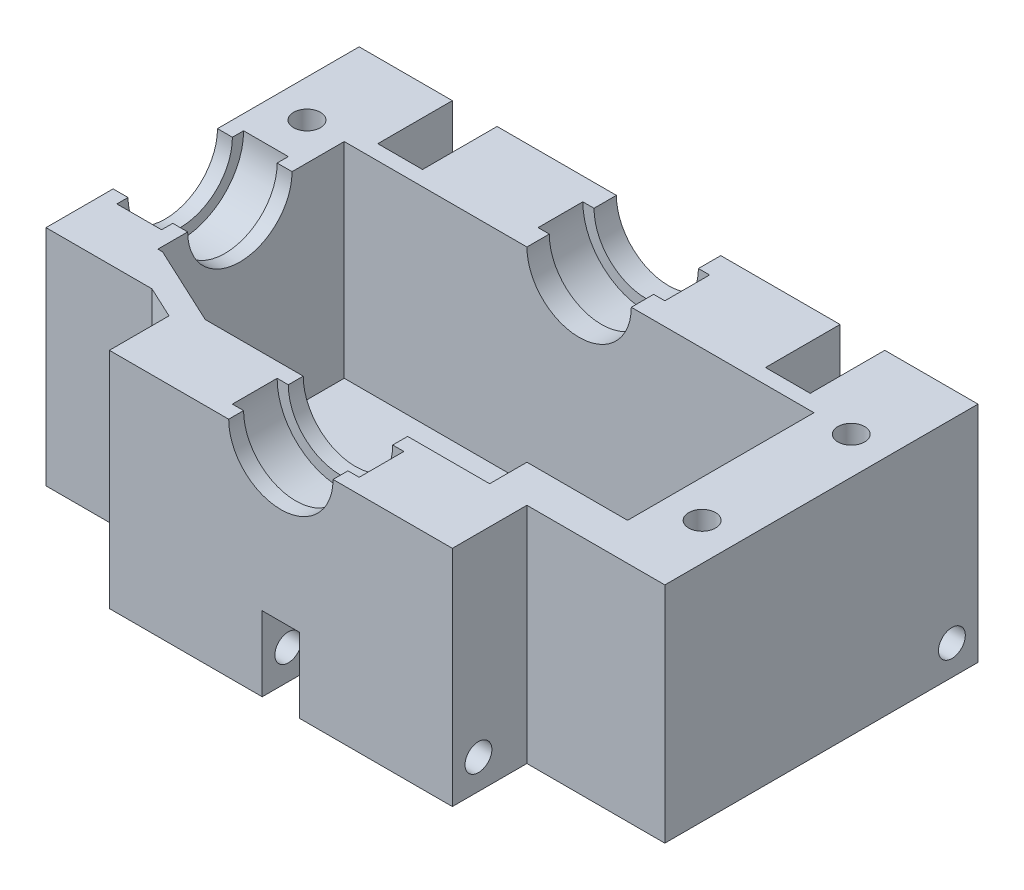
from build123d import *

# Parameters (mm, degrees)
BOSS_EXTRUDE1_DEPTH  = 30
CUT_EXTRUDE2_START   = 2.5
CUT_EXTRUDE2_DEPTH   = 27.5
CUT_EXTRUDE3_START   = -2
SKETCH3_R            = 8.5
CUT_EXTRUDE3_DEPTH   = 6
CUT_EXTRUDE4_START   = -9
SKETCH4_R            = 8.5
CUT_EXTRUDE4_DEPTH   = 6
CUT_EXTRUDE6_DEPTH   = 73.981161953
SKETCH16_W           = 6
SKETCH16_H           = 30
CUT_EXTRUDE7_DEPTH   = 10
CUT_EXTRUDE8_START   = 2
SKETCH17_R           = 8.5
CUT_EXTRUDE8_DEPTH   = 6
CUT_EXTRUDE9_REACH   = 98.897
CHAMFER1_SIZE        = 2
CHAMFER1_SIZE2       = 4.289013841
CHAMFER2_SIZE        = 12.867041523
CHAMFER2_SIZE_2      = 6
SKETCH19_W           = 5
SKETCH19_H           = 7
CUT_EXTRUDE11_DEPTH  = 10
M3_CLEARANCE_HOLE1_D = 3.6
M3_CLEARANCE_HOLE2_D = 3.6


with BuildPart() as part:
    # Sketch1 → Boss-Extrude1 (new body)
    with BuildSketch(Plane(origin=(0, 0, 0), x_dir=(1, 0, 0), z_dir=(0, 1, 0))):
        Polygon((-41.5, 12), (41.5, 12), (41.5, -15), (41.5, -30), (23, -30), (23, -40), (-23, -40), (-23, -30), (-41.5, -30), (-41.5, -15), align=None)
    extrude(amount=BOSS_EXTRUDE1_DEPTH)

    # Sketch1<4> → Cut-Extrude2 (cut)
    with BuildSketch(Plane(origin=(0, 0, 0), x_dir=(1, 0, 0), z_dir=(0, 1, 0)).offset(CUT_EXTRUDE2_START)):
        Polygon((31.5, 0), (-31.5, 0), (-31.5, -10), (-31.5, -25), (-18, -25), (-18, -30), (18, -30), (18, -25), (31.5, -25), (31.5, -10), align=None)
    extrude(amount=CUT_EXTRUDE2_DEPTH, mode=Mode.SUBTRACT)

    # Sketch3 → Cut-Extrude3 (cut)
    with BuildSketch(Plane.XY.offset(40).offset(CUT_EXTRUDE3_START)):
        with Locations((0, 30)):
            Circle(SKETCH3_R)
    extrude(amount=-CUT_EXTRUDE3_DEPTH, mode=Mode.SUBTRACT)

    # Sketch4 → Cut-Extrude4 (cut)
    with BuildSketch(Plane(origin=(0, 0, -12), x_dir=(-1, 0, 0), z_dir=(0, 0, -1)).offset(CUT_EXTRUDE4_START)):
        with Locations((0, 30)):
            Circle(SKETCH4_R)
    extrude(amount=CUT_EXTRUDE4_DEPTH, mode=Mode.SUBTRACT)

    # Sketch3<4> → Cut-Extrude6 (cut, through all)
    with BuildSketch(Plane.XY.offset(40)):
        with BuildLine():
            Line((-7, 30), (7, 30))
            ThreePointArc((7, 30), (0, 37), (-7, 30))
        make_face()
        with BuildLine():
            ThreePointArc((-7, 30), (0, 23), (7, 30))
            Line((7, 30), (-7, 30))
        make_face()
        with BuildLine():
            Line((-7, 30), (7, 30))
            ThreePointArc((7, 30), (0, 37), (-7, 30))
        make_face()
        with BuildLine():
            ThreePointArc((-7, 30), (0, 23), (7, 30))
            Line((7, 30), (-7, 30))
        make_face()
    extrude(amount=-CUT_EXTRUDE6_DEPTH, mode=Mode.SUBTRACT)

    # Sketch16 → Cut-Extrude7 (cut)
    with BuildSketch(Plane(origin=(0, 0, -12), x_dir=(-1, 0, 0), z_dir=(0, 0, -1))):
        with Locations((26, 15)):
            Rectangle(SKETCH16_W, SKETCH16_H)
        with Locations((-26, 15)):
            Rectangle(SKETCH16_W, SKETCH16_H)
    extrude(amount=-CUT_EXTRUDE7_DEPTH, mode=Mode.SUBTRACT)

    # Sketch17 → Cut-Extrude8 (cut)
    with BuildSketch(Plane(origin=(-41.5, 0, 0), x_dir=(0, 0, -1), z_dir=(1, 0, 0)).offset(CUT_EXTRUDE8_START)):
        with Locations((-14, 30)):
            Circle(SKETCH17_R)
    extrude(amount=CUT_EXTRUDE8_DEPTH, mode=Mode.SUBTRACT)

    # Cut-Extrude9: up to this face of the body (flat: up to its plane)
    cut_extrude9_end = Plane(part.part.faces().sort_by_distance((-31.5, 16.25, 12.5))[0])
    # Sketch17<3> → Cut-Extrude9 (cut, up to the picked face)
    with BuildSketch(Plane(origin=(-41.5, 0, 0), x_dir=(0, 0, -1), z_dir=(1, 0, 0)), mode=Mode.PRIVATE) as cut_extrude9_sk1:
        with BuildLine():
            Line((-21, 30), (-7, 30))
            ThreePointArc((-7, 30), (-14, 37), (-21, 30))
        make_face()
    cut_extrude9_tool1 = split(extrude(cut_extrude9_sk1.sketch, amount=CUT_EXTRUDE9_REACH, mode=Mode.PRIVATE), bisect_by=cut_extrude9_end, keep=Keep.BOTH, mode=Mode.PRIVATE)
    # Sketch17<3> → Cut-Extrude9 (cut, up to the picked face)
    with BuildSketch(Plane(origin=(-41.5, 0, 0), x_dir=(0, 0, -1), z_dir=(1, 0, 0)), mode=Mode.PRIVATE) as cut_extrude9_sk2:
        with BuildLine():
            ThreePointArc((-21, 30), (-14, 23), (-7, 30))
            Line((-7, 30), (-21, 30))
        make_face()
    cut_extrude9_tool2 = split(extrude(cut_extrude9_sk2.sketch, amount=CUT_EXTRUDE9_REACH, mode=Mode.PRIVATE), bisect_by=cut_extrude9_end, keep=Keep.BOTH, mode=Mode.PRIVATE)
    # Sketch17<3> → Cut-Extrude9 (cut, up to the picked face)
    with BuildSketch(Plane(origin=(-41.5, 0, 0), x_dir=(0, 0, -1), z_dir=(1, 0, 0)), mode=Mode.PRIVATE) as cut_extrude9_sk3:
        with BuildLine():
            Line((-21, 30), (-7, 30))
            ThreePointArc((-7, 30), (-14, 37), (-21, 30))
        make_face()
    cut_extrude9_tool3 = split(extrude(cut_extrude9_sk3.sketch, amount=CUT_EXTRUDE9_REACH, mode=Mode.PRIVATE), bisect_by=cut_extrude9_end, keep=Keep.BOTH, mode=Mode.PRIVATE)
    # Sketch17<3> → Cut-Extrude9 (cut, up to the picked face)
    with BuildSketch(Plane(origin=(-41.5, 0, 0), x_dir=(0, 0, -1), z_dir=(1, 0, 0)), mode=Mode.PRIVATE) as cut_extrude9_sk4:
        with BuildLine():
            ThreePointArc((-21, 30), (-14, 23), (-7, 30))
            Line((-7, 30), (-21, 30))
        make_face()
    cut_extrude9_tool4 = split(extrude(cut_extrude9_sk4.sketch, amount=CUT_EXTRUDE9_REACH, mode=Mode.PRIVATE), bisect_by=cut_extrude9_end, keep=Keep.BOTH, mode=Mode.PRIVATE)
    add(cut_extrude9_tool1.solids().sort_by(Axis((-41.5, 32.970892, 14), (1, 0, 0)))[0], mode=Mode.SUBTRACT)
    add(cut_extrude9_tool2.solids().sort_by(Axis((-41.5, 27.029108, 14), (1, 0, 0)))[0], mode=Mode.SUBTRACT)
    add(cut_extrude9_tool3.solids().sort_by(Axis((-41.5, 32.970892, 14), (1, 0, 0)))[0], mode=Mode.SUBTRACT)
    add(cut_extrude9_tool4.solids().sort_by(Axis((-41.5, 27.029108, 14), (1, 0, 0)))[0], mode=Mode.SUBTRACT)

    # Chamfer1
    chamfer1_edges = [part.edges().sort_by_distance(p)[0] for p in [
        (-23, 15, 30),
    ]]
    chamfer1_side = [part.faces().sort_by_distance(p)[0] for p in [
        (-23, 15, 35),
    ]]
    chamfer(chamfer1_edges, length=CHAMFER1_SIZE, length2=CHAMFER1_SIZE2, reference=chamfer1_side[0])

    # Chamfer2
    # the kernel refuses this chamfer: 12.867041523, 6 mm, written as the material it takes off along each edge
    with BuildSketch(Plane(origin=(-18, 2.5, 25), x_dir=(-0.9998669641130704, 0, -0.016311164131110355), z_dir=(0, 1, 0))) as chamfer2_piece_1_section:
        Polygon((CHAMFER2_SIZE * 0.999866964118, CHAMFER2_SIZE * 0.0163111641312), (-CHAMFER2_SIZE_2 * 0.0163111641311, CHAMFER2_SIZE_2 * 0.999866964113), (0, 0), align=None)
    chamfer2_piece_1 = extrude(amount=60.838188976, mode=Mode.PRIVATE)
    chamfer2_piece_1 = split(chamfer2_piece_1, bisect_by=Plane(origin=(-22.391133218, 16.25, 30), z_dir=(0, 0, -1)), keep=Keep.TOP, mode=Mode.PRIVATE)
    add(chamfer2_piece_1, mode=Mode.SUBTRACT)

    # Sketch19 → Cut-Extrude11 (cut)
    with BuildSketch(Plane.XZ):
        with Locations((0, -8.5)):
            Rectangle(SKETCH19_W, SKETCH19_H)
        with Locations((0, 36.5)):
            Rectangle(SKETCH19_W, SKETCH19_H)
    extrude(amount=-CUT_EXTRUDE11_DEPTH, mode=Mode.SUBTRACT)

    # M3 Clearance Hole1 (through all)
    with Locations(Plane(origin=(41.5, 0, 0), x_dir=(0, 0, -1), z_dir=(1, 0, 0))):
        with Locations((8.5, 4), (-36.5, 4)):
            Hole(M3_CLEARANCE_HOLE1_D / 2)

    # M3 Clearance Hole2 (through all)
    with Locations(Plane(origin=(0, 30, 0), x_dir=(1, 0, 0), z_dir=(0, 1, 0))):
        with Locations((-36.5, 0), (36.5, 0), (36.5, -20)):
            Hole(M3_CLEARANCE_HOLE2_D / 2)


solid = part.part
